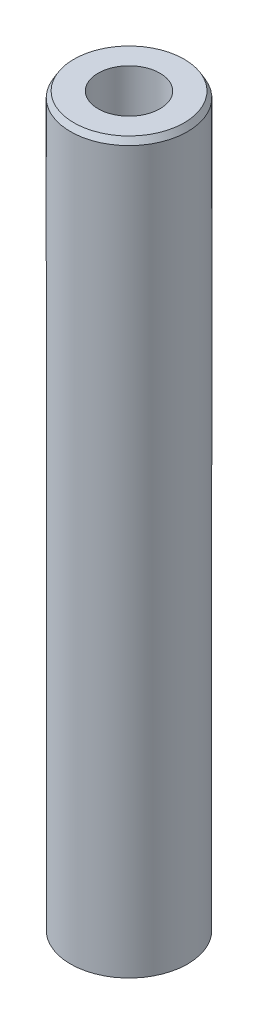
from build123d import *
from OCP.BRepFilletAPI import BRepFilletAPI_MakeChamfer

# Parameters (mm, degrees)
SKETCH1_R           = 15
BOSS_EXTRUDE1_DEPTH = 187.034323666
SKETCH2_R           = 7.916197319
CUT_EXTRUDE1_DEPTH  = 189.233467346
CHAMFER1_SIZE       = 1.519588046
CHAMFER1_SIZE2      = 0.877334568


with BuildPart() as part:
    # Sketch1 → Boss-Extrude1 (new body)
    with BuildSketch(Plane(origin=(0, 0, 0), x_dir=(1, 0, 0), z_dir=(0, 1, 0))):
        Circle(SKETCH1_R)
    extrude(amount=BOSS_EXTRUDE1_DEPTH)

    # Sketch2 → Cut-Extrude1 (cut, through all)
    with BuildSketch(Plane(origin=(0, 0, 0), x_dir=(1, 0, 0), z_dir=(0, 1, 0))):
        Circle(SKETCH2_R)
    extrude(amount=CUT_EXTRUDE1_DEPTH, mode=Mode.SUBTRACT)

    # Chamfer1: one chamfer whose edges measure the first distance from different faces: ONE call of the kernel's chamfer builder (chamfer() names one face for all edges)
    chamfer1_edges_1 = [part.edges().sort_by_distance(p)[0] for p in [
        (-15, 187.034323666, 0),
    ]]
    chamfer1_side_1 = [part.faces().sort_by_distance(p)[0] for p in [
        (-15, 93.517161833, 0),
    ]]
    chamfer1_edges_2 = [part.edges().sort_by_distance(p)[0] for p in [
        (-15, 0, 0),
    ]]
    chamfer1_side_2 = [part.faces().sort_by_distance(p)[0] for p in [
        (-14.575735931, 0, 0),
    ]]
    chamfer1 = BRepFilletAPI_MakeChamfer(part.part.solid().wrapped)
    for e in chamfer1_edges_1:
        chamfer1.Add(CHAMFER1_SIZE, CHAMFER1_SIZE2, e.wrapped, chamfer1_side_1[0].wrapped)  # the first distance lies on this face
    for e in chamfer1_edges_2:
        chamfer1.Add(CHAMFER1_SIZE, CHAMFER1_SIZE2, e.wrapped, chamfer1_side_2[0].wrapped)  # the first distance lies on this face
    add(Compound.cast(chamfer1.Shape()), mode=Mode.REPLACE)


solid = part.part
